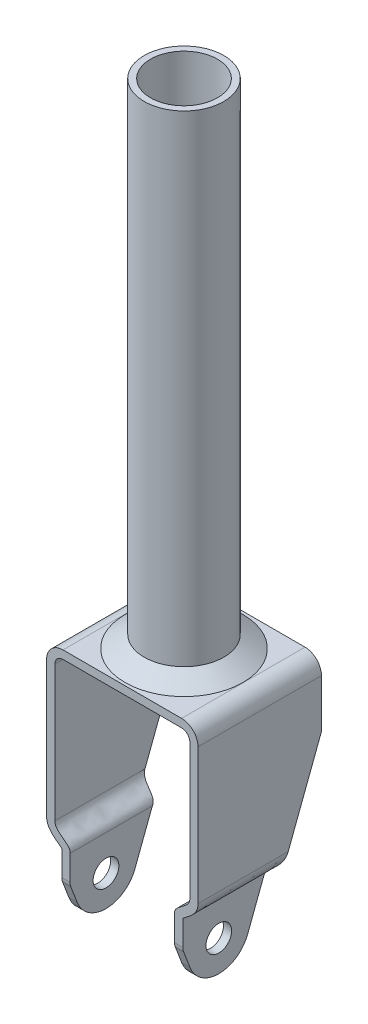
from build123d import *

# Parameters (mm, degrees)
EXTRUDE_THIN1_DEPTH = 38.1
CUT_EXTRUDE1_DEPTH  = 96.205221294
SKETCH5_R           = 3.96875
CUT_EXTRUDE2_DEPTH  = 96.205221294
SKETCH6_R           = 12.2936
SKETCH6_R_2         = 10.342534733
BOSS_EXTRUDE2_DEPTH = 152.4
SKETCH8_R           = 18.199007784
SKETCH7_R           = 10.342534733


# Read off the part's stored shape, not the designer's step: Extrude-Thin1
with BuildPart() as part:
    # Extrude-Thin1 outline → Extrude-Thin1 (new body)
    with BuildSketch(Plane.XY):
        with BuildLine():
            Line((-18.6817, 20.38347688), (-18.6817, 0))
            Line((-18.6817, 0), (-16.1417, 0))
            Line((-16.1417, 0), (-16.1417, 20.32))
            add(Edge.make_bspline(
                [(-20.8407, 26.67), (-20.8407, 23.763857752), (-15.646351535, 22.789211476), (-16.1417, 20.32)],
                knots=[0, 0, 0, 0, 1, 1, 1, 1], degree=3))
            Line((-20.8407, 26.67), (-20.8407, 68.58))
            ThreePointArc((-20.8407, 68.58), (-20.096751224, 70.376051224), (-18.3007, 71.12))
            Line((-18.3007, 71.12), (18.3007, 71.12))
            ThreePointArc((18.3007, 71.12), (20.096751224, 70.376051224), (20.8407, 68.58))
            Line((20.8407, 68.58), (20.8407, 26.67))
            add(Edge.make_bspline(
                [(16.1417, 20.32), (15.646351535, 22.789211476), (20.8407, 23.763857752), (20.8407, 26.67)],
                knots=[0, 0, 0, 0, 1, 1, 1, 1], degree=3))
            Line((16.1417, 20.32), (16.1417, 0))
            Line((16.1417, 0), (18.6817, 0))
            Line((18.6817, 0), (18.6817, 20.38347688))
            add(Edge.make_bspline(
                [(18.6817, 20.38347688), (18.765268898, 20.466690468), (18.888895007, 20.57668849), (19.198318415, 20.827254502), (19.383759179, 20.968114578), (19.796479851, 21.275209729), (20.023736725, 21.441568971), (20.503556211, 21.804901686), (20.7562224, 22.001844549), (21.272496014, 22.440788491), (21.53645688, 22.68275476), (22.056971887, 23.237206576), (22.314275473, 23.550298766), (22.782632726, 24.278317238), (22.993321794, 24.695356067), (23.294062312, 25.62890672), (23.3807, 26.144600529), (23.3807, 26.67)],
                knots=[0, 0, 0, 0, 0.125, 0.125, 0.25, 0.25, 0.375, 0.375, 0.5, 0.5, 0.625, 0.625, 0.75, 0.75, 0.875, 0.875, 1, 1, 1, 1], degree=3))
            Line((23.3807, 26.67), (23.3807, 68.58))
            ThreePointArc((23.3807, 68.58), (21.892802448, 72.172102448), (18.3007, 73.66))
            Line((18.3007, 73.66), (-18.3007, 73.66))
            ThreePointArc((-18.3007, 73.66), (-21.892802448, 72.172102448), (-23.3807, 68.58))
            Line((-23.3807, 68.58), (-23.3807, 26.67))
            add(Edge.make_bspline(
                [(-23.3807, 26.67), (-23.3807, 26.144600529), (-23.294062312, 25.62890672), (-22.993321794, 24.695356067), (-22.782632726, 24.278317238), (-22.314275473, 23.550298766), (-22.056971887, 23.237206576), (-21.53645688, 22.68275476), (-21.272496014, 22.440788491), (-20.7562224, 22.001844549), (-20.503556211, 21.804901686), (-20.023736725, 21.441568971), (-19.796479851, 21.275209729), (-19.383759179, 20.968114578), (-19.198318415, 20.827254502), (-18.888895007, 20.57668849), (-18.765268898, 20.466690468), (-18.6817, 20.38347688)],
                knots=[0, 0, 0, 0, 0.125, 0.125, 0.25, 0.25, 0.375, 0.375, 0.5, 0.5, 0.625, 0.625, 0.75, 0.75, 0.875, 0.875, 1, 1, 1, 1], degree=3))
        make_face()
    extrude(amount=EXTRUDE_THIN1_DEPTH)

    # Sketch3 → Cut-Extrude1 (cut, through all)
    with BuildSketch(Plane.ZY.offset(23.3807)):
        with BuildLine():
            Line((18.086653696, 6.133752432), (0, 53.604932722))
            Line((0, 53.604932722), (0, 0))
            Line((0, 0), (26.9875, 0))
            ThreePointArc((26.9875, 0), (21.582687704, 1.681937521), (18.086653696, 6.133752432))
        make_face()
        with BuildLine():
            ThreePointArc((35.888346304, 6.133752432), (32.392312296, 1.681937521), (26.9875, 0))
            Line((26.9875, 0), (38.1, 0))
            Line((38.1, 0), (38.1, 12.596443014))
            ThreePointArc((38.1, 12.596443014), (38.040956068, 11.949441708), (37.865774898, 11.323815275))
            Line((37.865774898, 11.323815275), (35.888346304, 6.133752432))
        make_face()
    extrude(amount=-CUT_EXTRUDE1_DEPTH, mode=Mode.SUBTRACT)

    # Sketch5 → Cut-Extrude2 (cut, through all)
    with BuildSketch(Plane.ZY.offset(23.3807)):
        with Locations((26.9875, 9.525)):
            Circle(SKETCH5_R)
    extrude(amount=-CUT_EXTRUDE2_DEPTH, mode=Mode.SUBTRACT)

    # Sketch6 → Boss-Extrude2 (add)
    with BuildSketch(Plane(origin=(0, 73.66, 0), x_dir=(1, 0, 0), z_dir=(0, 1, 0))):
        with Locations(Location((0, -19.05, 0), (0, 0, 90))):
            Circle(SKETCH6_R)
        with Locations(Location((0, -19.05, 0), (0, 0, 90))):
            Circle(SKETCH6_R_2, mode=Mode.SUBTRACT)
    extrude(amount=BOSS_EXTRUDE2_DEPTH)

    # Sketch8 → Loft2 section 0
    with BuildSketch(Plane(origin=(0, 73.66, 0), x_dir=(1, 0, 0), z_dir=(0, 1, 0))):
        with Locations((0, -19.05)):
            Circle(SKETCH8_R)
    # Sketch7 → Loft2 section 1
    with BuildSketch(Plane(origin=(0, 78.74, 0), x_dir=(1, 0, 0), z_dir=(0, 1, 0))):
        with Locations((0, -19.05)):
            Circle(SKETCH7_R)
    loft()


solid = part.part
